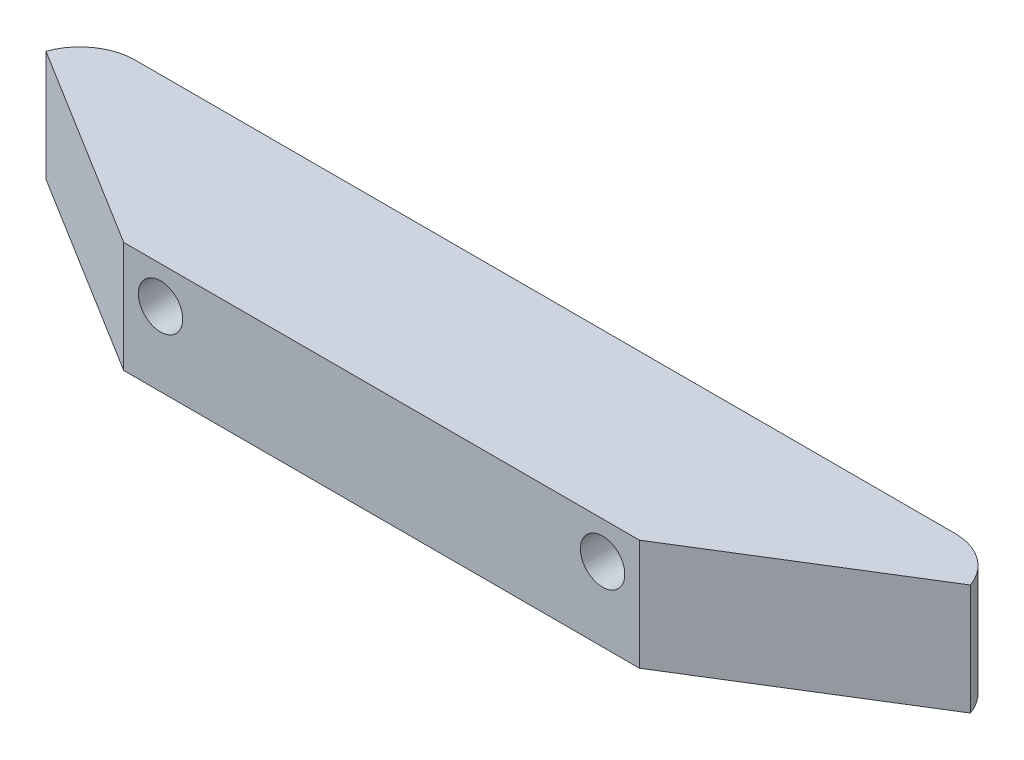
from build123d import *

# Parameters (mm, degrees)
BOSS_EXTRUDE1_DEPTH = 12
SKETCH3_R           = 2.4
CUT_EXTRUDE1_DEPTH  = 8.5
FILLET1_R           = 6


with BuildPart() as part:
    # Sketch1 → Boss-Extrude1 (new body)
    with BuildSketch(Plane(origin=(0, 0, 0), x_dir=(1, 0, 0), z_dir=(0, 1, 0))):
        Polygon((-50, 17.7), (50, 17.7), (50, 13.7), (27.895, 0), (-27.895, 0), (-50, 13.7), align=None)
    extrude(amount=BOSS_EXTRUDE1_DEPTH)

    # Sketch3 → Cut-Extrude1 (cut)
    with BuildSketch(Plane.XY):
        with Locations((-23.91, 8)):
            Circle(SKETCH3_R)
        with Locations(Location((23.91, 8, 0), (0, 0, 180))):
            Circle(SKETCH3_R)
    extrude(amount=-CUT_EXTRUDE1_DEPTH, mode=Mode.SUBTRACT)

    # Fillet1
    # the kernel refuses this fillet: 6 mm, written as the material it takes off along each edge
    with BuildSketch(Plane(origin=(50, -14.142135624, -17.7), x_dir=(-1, 0, 0), z_dir=(0, 1, 0))) as fillet1_piece_1:
        with BuildLine():
            CenterArc((5.656854249, 6), FILLET1_R, 199.471220634, 70.528779366)
            Line((0, 4), (-0.113137085, 3.96))
            ThreePointArc((-0.113137085, 3.96), (-0.12, 2), (-0.12, 0))
            Line((-0.12, 0), (0, -0.12))
            Line((0, -0.12), (5.656854249, -0.12))
            Line((5.656854249, -0.12), (5.656854249, 0))
        make_face()
    extrude(amount=40.284271247, mode=Mode.SUBTRACT)
    with BuildSketch(Plane(origin=(-50, -14.142135624, -17.7), x_dir=(1, 0, 0), z_dir=(0, 1, 0))) as fillet1_piece_2:
        with BuildLine():
            CenterArc((5.656854249, -6), FILLET1_R, 90, 70.528779366)
            Line((0, -4), (-0.113137085, -3.96))
            ThreePointArc((-0.113137085, -3.96), (-0.12, -2), (-0.12, 0))
            Line((-0.12, 0), (0, 0.12))
            Line((0, 0.12), (5.656854249, 0.12))
            Line((5.656854249, 0.12), (5.656854249, 0))
        make_face()
    extrude(amount=40.284271247, mode=Mode.SUBTRACT)


solid = part.part
